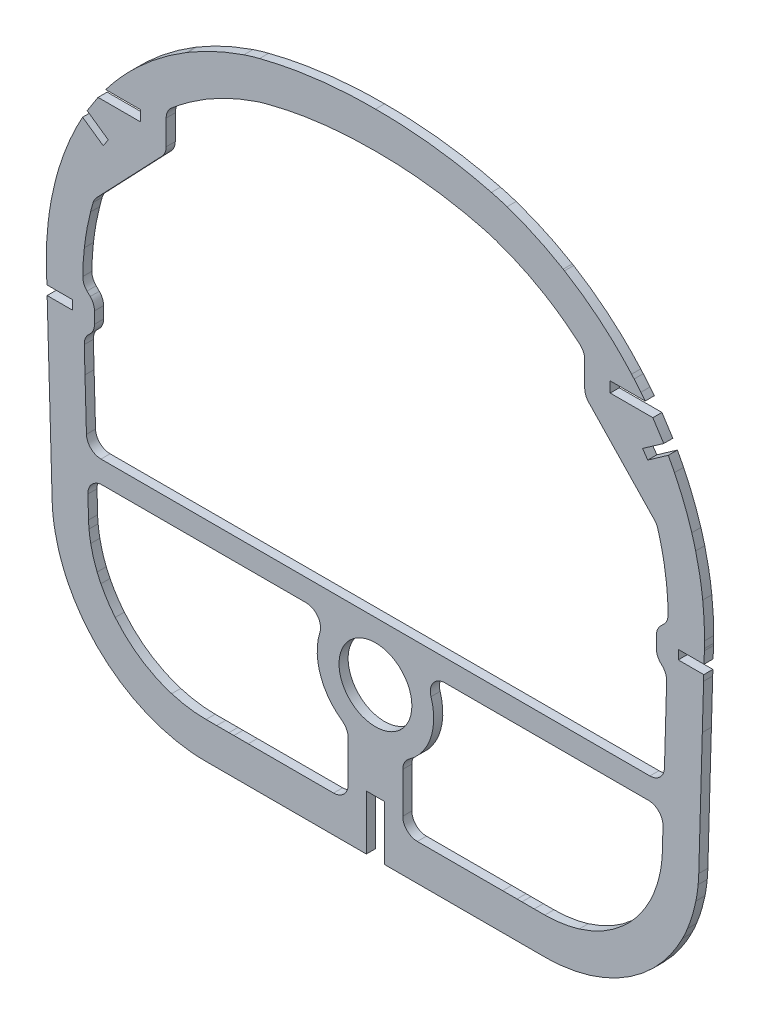
from build123d import *

# Parameters (mm, degrees)
SKETCH1_R           = 12.700000000000001
BOSS_EXTRUDE1_DEPTH = 1.5875
SKETCH2_R           = 20.320000000000004
CUT_EXTRUDE1_DEPTH  = 169.34386796933504
BOSS_EXTRUDE2_START = -3.175
BOSS_EXTRUDE2_DEPTH = 3.175
CUT_EXTRUDE3_DEPTH  = 169.34386796933504
FILLET1_R           = 5.08


with BuildPart() as part:
    # Sketch1 → Boss-Extrude1 (new, symmetric)
    with BuildSketch(Plane.XY):
        with BuildLine():
            Line((-114.7452197006329, 17.502683519570404), (-114.72594109896555, 16.83199064857102))
            add(Edge.make_bspline(
                [(-114.72594109896555, 16.83199064857102), (-114.63641058990241, 13.717126836218588), (-114.54692036583873, 10.602259401409691), (-114.45747777614487, 7.487385264694304)],
                knots=[0, 0, 0, 0, 1, 1, 1, 1], degree=3, weights=[1, 1, 1, 1]))
            add(Edge.make_bspline(
                [(-114.45747777614487, 7.487385264694304), (-114.30718797143473, 2.253479661651684), (-114.15700866213814, -2.980453956785725), (-114.00699685839271, -8.214429233663035)],
                knots=[0, 0, 0, 0, 1, 1, 1, 1], degree=3, weights=[1, 1, 1, 1]))
            add(Edge.make_bspline(
                [(-114.00699685839271, -8.214429233663035), (-113.594092007642, -22.620853681126103), (-113.18138690950695, -37.02768380672695), (-112.76874515326054, -51.434848977248656)],
                knots=[0, 0, 0, 0, 1, 1, 1, 1], degree=3, weights=[1, 1, 1, 1]))
            ThreePointArc((-112.76874515326054, -51.434848977248656), (-112.68804333866615, -53.1759331373922), (-112.55087678962421, -54.91348088447918))
            ThreePointArc((-112.55087678962421, -54.91348088447918), (-112.22797864595222, -57.58878393541259), (-111.77128477130692, -60.244521183405745))
            add(Edge.make_bspline(
                [(-111.77128477130692, -60.244521183405745), (-111.1073733148537, -63.598835081976574), (-110.12206449281399, -66.88944897002129), (-108.83322390889208, -70.0566544796016)],
                knots=[0, 0, 0, 0, 1, 1, 1, 1], degree=3, weights=[1, 1, 1, 1]))
            ThreePointArc((-108.83322390889208, -70.0566544796016), (-108.01356493798, -71.96435471079279), (-107.12076116778223, -73.83893797877646))
            add(Edge.make_bspline(
                [(-107.12076116778223, -73.83893797877646), (-105.32883254477298, -77.42121554975256), (-103.13441882445123, -80.80203517755982), (-100.59192102351365, -83.8972820272281)],
                knots=[0, 0, 0, 0, 1, 1, 1, 1], degree=3, weights=[1, 1, 1, 1]))
            add(Edge.make_bspline(
                [(-100.59192102351365, -83.8972820272281), (-95.59242527238186, -89.98368785895089), (-89.40102010512265, -95.0940325478926), (-82.31665423774274, -98.86998494857941), (-74.78459324955335, -101.17197690928097)],
                knots=[0, 0, 0, 0, 0, 1, 1, 1, 1, 1], degree=4, weights=[1, 1, 1, 1, 1]))
            add(Edge.make_bspline(
                [(-74.78459324955335, -101.17197690928097), (-69.70375314313806, -102.72481259724978), (-64.39158382619704, -103.51812327161942), (-59.07890091428872, -103.51750007032157)],
                knots=[0, 0, 0, 0, 1, 1, 1, 1], degree=3, weights=[1, 1, 1, 1]))
            add(Edge.make_bspline(
                [(-59.07890091428872, -103.51750007032157), (-57.846433259477166, -103.51735549787801), (-56.61397530630568, -103.51723826558838), (-55.38152448537701, -103.517145846477)],
                knots=[0, 0, 0, 0, 1, 1, 1, 1], degree=3, weights=[1, 1, 1, 1]))
            add(Edge.make_bspline(
                [(-55.38152448537701, -103.517145846477), (-53.95716671470069, -103.51703903855777), (-52.53281923226491, -103.51696799755912), (-51.10847777162478, -103.5169356729528)],
                knots=[0, 0, 0, 0, 1, 1, 1, 1], degree=3, weights=[1, 1, 1, 1]))
            Line((-51.10847777162478, -103.5169356729528), (-49.37860046686426, -103.51691546671823))
            add(Edge.make_bspline(
                [(-49.37860046686426, -103.51691546671823), (-47.71016069532774, -103.5169146296126), (-46.04172764724473, -103.51696183124892), (-44.37329370146884, -103.51707762925778)],
                knots=[0, 0, 0, 0, 1, 1, 1, 1], degree=3, weights=[1, 1, 1, 1]))
            add(Edge.make_bspline(
                [(-44.37329370146884, -103.51707762925778), (-29.582422277033825, -103.51810415951752), (-14.791380965373275, -103.51962644471186), (-1.5811525e-09, -103.52167238588633)],
                knots=[0, 0, 0, 0, 1, 1, 1, 1], degree=3, weights=[1, 1, 1, 1]))
            add(Edge.make_bspline(
                [(44.37329370146884, -103.51707762925778), (29.582422277033825, -103.51810415951752), (14.791380965373275, -103.51962644471186), (-1.5811525e-09, -103.52167238588633)],
                knots=[0, 0, 0, 0, 1, 1, 1, 1], degree=3, weights=[1, 1, 1, 1]))
            add(Edge.make_bspline(
                [(49.37860046686426, -103.51691546671823), (47.71016069532774, -103.5169146296126), (46.04172764724473, -103.51696183124892), (44.37329370146884, -103.51707762925778)],
                knots=[0, 0, 0, 0, 1, 1, 1, 1], degree=3, weights=[1, 1, 1, 1]))
            Line((49.37860046686426, -103.51691546671823), (51.10847777162478, -103.5169356729528))
            add(Edge.make_bspline(
                [(55.38152448537701, -103.517145846477), (53.95716671470069, -103.51703903855777), (52.53281923226491, -103.51696799755912), (51.10847777162478, -103.5169356729528)],
                knots=[0, 0, 0, 0, 1, 1, 1, 1], degree=3, weights=[1, 1, 1, 1]))
            add(Edge.make_bspline(
                [(59.07890091428872, -103.51750007032157), (57.846433259477166, -103.51735549787801), (56.61397530630568, -103.51723826558838), (55.38152448537701, -103.517145846477)],
                knots=[0, 0, 0, 0, 1, 1, 1, 1], degree=3, weights=[1, 1, 1, 1]))
            add(Edge.make_bspline(
                [(74.78459324955335, -101.17197690928097), (69.70375314313806, -102.72481259724978), (64.39158382619704, -103.51812327161942), (59.07890091428872, -103.51750007032157)],
                knots=[0, 0, 0, 0, 1, 1, 1, 1], degree=3, weights=[1, 1, 1, 1]))
            add(Edge.make_bspline(
                [(100.59192102351365, -83.8972820272281), (95.59242527238186, -89.98368785895089), (89.40102010512265, -95.0940325478926), (82.31665423774274, -98.86998494857941), (74.78459324955335, -101.17197690928097)],
                knots=[0, 0, 0, 0, 0, 1, 1, 1, 1, 1], degree=4, weights=[1, 1, 1, 1, 1]))
            add(Edge.make_bspline(
                [(107.12076116778223, -73.83893797877646), (105.32883254477298, -77.42121554975256), (103.13441882445123, -80.80203517755982), (100.59192102351365, -83.8972820272281)],
                knots=[0, 0, 0, 0, 1, 1, 1, 1], degree=3, weights=[1, 1, 1, 1]))
            ThreePointArc((107.12076116778223, -73.83893797877646), (108.01356493798, -71.9643547107928), (108.83322390889208, -70.0566544796016))
            add(Edge.make_bspline(
                [(111.77128477130692, -60.244521183405745), (111.1073733148537, -63.598835081976574), (110.12206449281399, -66.88944897002129), (108.83322390889208, -70.0566544796016)],
                knots=[0, 0, 0, 0, 1, 1, 1, 1], degree=3, weights=[1, 1, 1, 1]))
            ThreePointArc((111.77128477130692, -60.244521183405745), (112.22797864595222, -57.58878393541259), (112.55087678962421, -54.91348088447918))
            ThreePointArc((112.55087678962421, -54.91348088447918), (112.68804333866615, -53.17593313739219), (112.76874515326054, -51.434848977248656))
            add(Edge.make_bspline(
                [(114.00699685839271, -8.214429233663035), (113.594092007642, -22.620853681126103), (113.18138690950695, -37.02768380672695), (112.76874515326054, -51.434848977248656)],
                knots=[0, 0, 0, 0, 1, 1, 1, 1], degree=3, weights=[1, 1, 1, 1]))
            add(Edge.make_bspline(
                [(114.45747777614487, 7.487385264694304), (114.30718797143473, 2.253479661651684), (114.15700866213814, -2.980453956785725), (114.00699685839271, -8.214429233663035)],
                knots=[0, 0, 0, 0, 1, 1, 1, 1], degree=3, weights=[1, 1, 1, 1]))
            add(Edge.make_bspline(
                [(114.72594109896555, 16.83199064857102), (114.63641058990241, 13.717126836218588), (114.54692036583873, 10.602259401409691), (114.45747777614487, 7.487385264694304)],
                knots=[0, 0, 0, 0, 1, 1, 1, 1], degree=3, weights=[1, 1, 1, 1]))
            Line((114.72594109896555, 16.83199064857102), (114.7452197006329, 17.502683519570404))
            add(Edge.make_bspline(
                [(114.7890059115134, 19.863219176694063), (114.7835780692486, 19.076239431927775), (114.76783208153577, 18.289356898186814), (114.7452197006329, 17.502683519570404)],
                knots=[0, 0, 0, 0, 0.9999498505076996, 0.9999498505076996, 0.9999498505076996, 0.9999498505076996], degree=3, weights=[1, 1, 1, 1]))
            add(Edge.make_bspline(
                [(114.15894327556961, 31.865695052286362), (114.60613845908075, 27.882027971749473), (114.81665344143374, 23.871808144028062), (114.7890059115134, 19.863219176694063)],
                knots=[0, 0, 0, 0, 1, 1, 1, 1], degree=3, weights=[1, 1, 1, 1]))
            add(Edge.make_bspline(
                [(111.684573502519, 45.4610336377593), (112.81734049393746, 40.992572366905875), (113.64469045396903, 36.44671950470451), (114.15894327556961, 31.865695052286362)],
                knots=[0, 0, 0, 0, 1, 1, 1, 1], degree=3, weights=[1, 1, 1, 1]))
            ThreePointArc((111.684573502519, 45.4610336377593), (111.03906135213371, 47.88139437458557), (110.3339195986165, 50.28505972985278))
            add(Edge.make_bspline(
                [(104.30641025218718, 65.4477511057322), (106.71886285229947, 60.56649996133052), (108.73674389160301, 55.49036874894405), (110.3339195986165, 50.28505972985278)],
                knots=[0, 0, 0, 0, 1, 1, 1, 1], degree=3, weights=[1, 1, 1, 1]))
            add(Edge.make_bspline(
                [(92.59150342724206, 83.84885261225975), (97.14327095044497, 78.16017149746612), (101.07854504066823, 71.97887259239612), (104.30641025218718, 65.4477511057322)],
                knots=[0.00015516687657362, 0.00015516687657362, 0.00015516687657362, 0.00015516687657362, 1, 1, 1, 1], degree=3, weights=[1, 1, 1, 1]))
            ThreePointArc((92.59150342724206, 83.84885261225975), (91.42507816905498, 85.2796957156788), (90.23277102888983, 86.6890443428995))
            ThreePointArc((90.23277102888983, 86.6890443428995), (89.79223213194632, 87.19683786942522), (89.34833219659208, 87.70169590196916))
            add(Edge.make_bspline(
                [(65.94432999771517, 107.22681485913718), (74.66889148105416, 101.94541730184362), (82.58894175346335, 95.33803001789981), (89.34833219659208, 87.70169590196916)],
                knots=[0, 0, 0, 0, 1, 1, 1, 1], degree=3, weights=[1, 1, 1, 1]))
            Line((65.94432999771517, 107.22681485913718), (65.49624085564622, 107.49648616368657))
            add(Edge.make_bspline(
                [(45.895792552675076, 116.5445185858013), (52.726322535675486, 114.23712446443145), (59.3094251803046, 111.19813338148634), (65.49624085564622, 107.49648616368657)],
                knots=[0, 0, 0, 0, 1, 1, 1, 1], degree=3, weights=[1, 1, 1, 1]))
            ThreePointArc((45.895792552675076, 116.5445185858013), (43.17799654744927, 117.40316616219629), (40.42839902855836, 118.1537687671607))
            add(Edge.make_bspline(
                [(40.42839902855836, 118.1537687671607), (39.33806183749876, 118.42838758689368), (37.1574632082568, 118.97760614678802), (33.85630153491988, 119.7094898902904), (30.535885824062376, 120.37426223953587), (27.19582924530948, 120.96549094489052), (23.838631119796016, 121.48509536527982), (20.465916690485443, 121.93269365848225), (17.079460248796543, 122.30850094608213), (13.680927413418125, 122.6123574228248), (10.271955070812115, 122.84468791805438), (6.8541610765224625, 123.00360566536389), (3.429096591574733, 123.09552645722273), (1.143477199439534, 123.09552645720133), (-1.58115076e-09, 123.09552645719057)],
                knots=[0, 0, 0, 0, 0.08319982321872643, 0.16639386599995798, 0.24958922098778757, 0.3327940500648784, 0.41601744163079, 0.49926927384300424, 0.5825600915037497, 0.6659009868953494, 0.7493034844056105, 0.8327794289788419, 0.9163408784672036, 1, 1, 1, 1], degree=3))
            add(Edge.make_bspline(
                [(-40.42839902855836, 118.1537687671607), (-39.33806183758537, 118.42838758688279), (-37.157463208516646, 118.97760614675535), (-33.85630153544102, 119.7094898902324), (-30.535885824845685, 120.37426223945792), (-27.19582924635577, 120.96549094479849), (-23.838631121105937, 121.48509536517938), (-20.465916692059512, 121.93269365837907), (-17.079460250635144, 122.30850094598189), (-13.680927415521507, 122.61235742273314), (-10.27195507318041, 122.84468791797694), (-6.854161079155658, 123.00360566530641), (-3.4290965944727594, 123.09552645719042), (-1.1434772025137092, 123.09552645719056), (-1.58115076e-09, 123.09552645719057)],
                knots=[0, 0, 0, 0, 0.08319982321872643, 0.16639386599995798, 0.24958922098778757, 0.3327940500648784, 0.41601744163079, 0.49926927384300424, 0.5825600915037497, 0.6659009868953494, 0.7493034844056105, 0.8327794289788419, 0.9163408784672036, 1, 1, 1, 1], degree=3))
            ThreePointArc((-40.42839902855836, 118.1537687671607), (-43.17799654744926, 117.4031661621963), (-45.895792552675076, 116.5445185858013))
            add(Edge.make_bspline(
                [(-45.895792552675076, 116.5445185858013), (-52.726322535675486, 114.23712446443145), (-59.3094251803046, 111.19813338148634), (-65.49624085564622, 107.49648616368657)],
                knots=[0, 0, 0, 0, 1, 1, 1, 1], degree=3, weights=[1, 1, 1, 1]))
            Line((-65.49624085564622, 107.49648616368657), (-65.94432999771517, 107.22681485913718))
            add(Edge.make_bspline(
                [(-65.94432999771517, 107.22681485913718), (-74.66889148105416, 101.94541730184362), (-82.58894175346335, 95.33803001789981), (-89.34833219659208, 87.70169590196916)],
                knots=[0, 0, 0, 0, 1, 1, 1, 1], degree=3, weights=[1, 1, 1, 1]))
            ThreePointArc((-89.34833219659208, 87.70169590196916), (-89.79223213194632, 87.19683786942522), (-90.23277102888983, 86.6890443428995))
            ThreePointArc((-90.23277102888983, 86.6890443428995), (-91.42507816905497, 85.27969571567883), (-92.59150342724206, 83.84885261225975))
            add(Edge.make_bspline(
                [(-92.59150342724206, 83.84885261225975), (-97.14327095044497, 78.16017149746612), (-101.07854504066823, 71.97887259239612), (-104.30641025218718, 65.4477511057322)],
                knots=[0.00015516687657362, 0.00015516687657362, 0.00015516687657362, 0.00015516687657362, 1, 1, 1, 1], degree=3, weights=[1, 1, 1, 1]))
            add(Edge.make_bspline(
                [(-104.30641025218718, 65.4477511057322), (-106.71886285229947, 60.56649996133052), (-108.73674389160301, 55.49036874894405), (-110.3339195986165, 50.28505972985278)],
                knots=[0, 0, 0, 0, 1, 1, 1, 1], degree=3, weights=[1, 1, 1, 1]))
            ThreePointArc((-110.3339195986165, 50.28505972985278), (-111.03906135213371, 47.881394374585554), (-111.684573502519, 45.4610336377593))
            add(Edge.make_bspline(
                [(-111.684573502519, 45.4610336377593), (-112.81734049393746, 40.992572366905875), (-113.64469045396903, 36.44671950470451), (-114.15894327556961, 31.865695052286362)],
                knots=[0, 0, 0, 0, 1, 1, 1, 1], degree=3, weights=[1, 1, 1, 1]))
            add(Edge.make_bspline(
                [(-114.15894327556961, 31.865695052286362), (-114.60613845908075, 27.882027971749473), (-114.81665344143374, 23.871808144028062), (-114.7890059115134, 19.863219176694063)],
                knots=[0, 0, 0, 0, 1, 1, 1, 1], degree=3, weights=[1, 1, 1, 1]))
            add(Edge.make_bspline(
                [(-114.7890059115134, 19.863219176694063), (-114.7835780692486, 19.076239431927775), (-114.76783208153577, 18.289356898186814), (-114.7452197006329, 17.502683519570404)],
                knots=[0, 0, 0, 0, 0.9999498505076996, 0.9999498505076996, 0.9999498505076996, 0.9999498505076996], degree=3, weights=[1, 1, 1, 1]))
        make_face()
        with Locations((0, -50.8)):
            Circle(SKETCH1_R, mode=Mode.SUBTRACT)
    extrude(amount=BOSS_EXTRUDE1_DEPTH, both=True)

    # Sketch2 → Cut-Extrude1 (cut, through all)
    with BuildSketch(Plane.XY.offset(1.5875)):
        with BuildLine():
            Line((-102.05046304501089, 17.867585498929238), (-102.03118420379151, 17.19688429403577))
            add(Edge.make_bspline(
                [(-102.03118420379151, 17.19688429403577), (-102.00880074568765, 16.41813943518699), (-101.96403890957323, 14.860650807524046), (-101.89691177324582, 12.524410000891692), (-101.82980105137004, 10.18816478438498), (-101.78507189346547, 8.630662089436115), (-101.76271032129195, 7.851911350464416)],
                knots=[-8.9129106647e-07, -8.9129106647e-07, -8.9129106647e-07, -8.9129106647e-07, 0.24999933153170015, 0.49999955435446675, 0.7499997771772333, 1, 1, 1, 1], degree=3))
            add(Edge.make_bspline(
                [(-101.76271032129195, 7.851911350464416), (-101.72513644418133, 6.543385290985036), (-101.65000280099126, 3.926340070305929), (-101.53734822694257, 0.00072939642337794), (-101.42474548905955, -3.9249044925446195), (-101.34971468786911, -6.542025090419771), (-101.31220993120635, -7.850581912197028)],
                knots=[0, 0, 0, 0, 0.25, 0.5, 0.75, 1, 1, 1, 1], degree=3))
            add(Edge.make_bspline(
                [(-101.31220993120635, -7.850581912197028), (-101.20900572823022, -11.451420095940556), (-101.00262463643593, -18.6530649395015), (-100.69311365187139, -29.45572791211675), (-100.38365329188234, -40.25848396259931), (-100.17736995172882, -47.4604370312094), (-100.07423324793606, -51.0613993294313)],
                knots=[0, 0, 0, 0, 0.2499430109272707, 0.4998860218545414, 0.7498290327818121, 0.9997720437090828, 0.9997720437090828, 0.9997720437090828, 0.9997720437090828], degree=3))
            ThreePointArc((-100.07423324793606, -51.0613993294313), (-100.01261182717461, -52.38633841552202), (-99.90816190893503, -53.70859065920598))
            ThreePointArc((-99.90816190893503, -53.70859065920598), (-99.66163291628735, -55.75113462094698), (-99.31295711405238, -57.77874098432134))
            add(Edge.make_bspline(
                [(-99.31295711405238, -57.77874098432134), (-99.18629820756037, -58.41866084206956), (-98.90236460900753, -59.692255532014435), (-98.38522585746843, -61.58227401578457), (-97.77853202516384, -63.4454753308098), (-97.31578928202734, -64.66552433544275), (-97.0699125288233, -65.26974468553459)],
                knots=[8.43480030505e-06, 8.43480030505e-06, 8.43480030505e-06, 8.43480030505e-06, 0.2500054480585301, 0.5000024613167552, 0.7499994745749803, 0.9999964878332054, 0.9999964878332054, 0.9999964878332054, 0.9999964878332054], degree=3))
            ThreePointArc((-97.0699125288233, -65.26974468553459), (-96.44413848330768, -66.72618981171381), (-95.76252267250297, -68.15735208346123))
            add(Edge.make_bspline(
                [(-95.76252267250297, -68.15735208346123), (-95.42072188376622, -68.84065093508114), (-94.69887081665928, -70.1877942842476), (-93.50307408806886, -72.14785264783423), (-92.19969597359791, -74.0380529132366), (-91.26318901742911, -75.24578261555591), (-90.77825654130869, -75.83614132440513)],
                knots=[3.67711913523e-06, 3.67711913523e-06, 3.67711913523e-06, 3.67711913523e-06, 0.2500027578393514, 0.5000018385595676, 0.7500009192797839, 1, 1, 1, 1], degree=3))
            add(Edge.make_bspline(
                [(-90.77825654130869, -75.83614132440513), (-89.5068666996648, -77.38393632849585), (-86.73246204698775, -80.2974199077113), (-81.9810924504027, -84.00890073067299), (-76.73882276751849, -86.98682408691383), (-72.98807379122894, -88.44114372697547), (-71.0726378596952, -89.02655031390347)],
                knots=[0, 0, 0, 0, 0.25, 0.5, 0.75, 1, 1, 1, 1], degree=3))
            add(Edge.make_bspline(
                [(-71.0726378596952, -89.02655031390347), (-70.10382176731555, -89.32264548159553), (-68.14473406941967, -89.84228531511037), (-65.14840486386493, -90.40375090675532), (-62.11878846703002, -90.74220704745068), (-60.09341988424078, -90.81761899052385), (-59.080390680675904, -90.81750015769968)],
                knots=[0, 0, 0, 0, 0.25, 0.5, 0.75, 1, 1, 1, 1], degree=3))
            add(Edge.make_bspline(
                [(-59.080390680675904, -90.81750015769968), (-58.77222793445742, -90.81746400921249), (-58.155900800659786, -90.81739512994476), (-57.23142012830801, -90.81730182892072), (-56.30694426326282, -90.81721830822251), (-55.690633155068674, -90.81716899023291), (-55.38247683389354, -90.81714588218439)],
                knots=[0, 0, 0, 0, 0.25, 0.5, 0.75, 1, 1, 1, 1], degree=3))
            add(Edge.make_bspline(
                [(-55.38247683389354, -90.81714588218439), (-55.026328467618264, -90.81711917578609), (-54.31403171190898, -90.81707023455843), (-53.24558692028407, -90.81701051424052), (-52.17714195004347, -90.81696476177872), (-51.46484462999912, -90.81694375722223), (-51.10869605403507, -90.81693567463611)],
                knots=[0, 0, 0, 0, 0.2500040917593769, 0.5000081835187538, 0.7500122752781306, 1.0000163670375075, 1.0000163670375075, 1.0000163670375075, 1.0000163670375075], degree=3))
            Line((-51.10869605403507, -90.81693567463611), (-49.37867782580123, -90.81691546675545))
            add(Edge.make_bspline(
                [(-49.37867782580123, -90.81691546675545), (-48.96149814615948, -90.81691525744405), (-48.127143203246426, -90.81692084348609), (-46.87558429083459, -90.81694916933752), (-45.62401153224609, -90.81699936889878), (-44.7896104068153, -90.81704870412081), (-44.37241225530023, -90.81707765984626)],
                knots=[-1.418230617083e-05, -1.418230617083e-05, -1.418230617083e-05, -1.418230617083e-05, 0.24998936327037188, 0.4999929088469146, 0.7499964544234573, 1, 1, 1, 1], degree=3))
            add(Edge.make_bspline(
                [(-44.37241225530023, -90.81707765984626), (-40.67475786507488, -90.81733428800648), (-33.5817552245195, -90.8178859946959), (-24.63983871217231, -90.81872725376154), (-17.244432865936744, -90.81951326702921), (-9.546700393673413, -90.82040355381663), (-3.697752930631585, -90.82116080223688), (-1.060272e-11, -90.82167226439844)],
                knots=[0, 0, 0, 0, 0.2499901033324907, 0.4795432670368797, 0.604538318703125, 0.749970309997472, 0.9999604133299628, 0.9999604133299628, 0.9999604133299628, 0.9999604133299628], degree=3))
            add(Edge.make_bspline(
                [(-1.060272e-11, -90.82167226439844), (3.697752930609162, -90.82116080223688), (9.54670039365822, -90.8204035538166), (17.244432865929777, -90.8195132670292), (24.63983871216943, -90.81872725376152), (33.58175522451756, -90.81788599469587), (40.67475786507284, -90.81733428800648), (44.372412283877324, -90.81707765984429)],
                knots=[3.958666948614e-05, 3.958666948614e-05, 3.958666948614e-05, 3.958666948614e-05, 0.2500296900021146, 0.3954616812968122, 0.5204567329631264, 0.7500098966673716, 1, 1, 1, 1], degree=3))
            add(Edge.make_bspline(
                [(44.372412283877324, -90.81707765984429), (44.78961040671183, -90.81704870412082), (45.624011531935736, -90.8169993688988), (46.87558429021371, -90.81694916933753), (48.127143202315146, -90.81692084348612), (48.96149814502146, -90.81691525744405), (49.378677824559816, -90.81691546675545)],
                knots=[0, 0, 0, 0, 0.2500035455145379, 0.5000070910290758, 0.7500106365436137, 1.0000141820581516, 1.0000141820581516, 1.0000141820581516, 1.0000141820581516], degree=3))
            Line((49.378677824559816, -90.81691546675545), (51.108696054035065, -90.81693567463611))
            add(Edge.make_bspline(
                [(51.108696054035065, -90.81693567463611), (51.46484462999911, -90.81694375722223), (52.177141950043456, -90.81696476177869), (53.245586920284026, -90.81701051424054), (54.3140317119089, -90.81707023455843), (55.02632846761824, -90.81711917578609), (55.38247681673545, -90.81714588218311)],
                knots=[-1.636703750918e-05, -1.636703750918e-05, -1.636703750918e-05, -1.636703750918e-05, 0.24998772472186812, 0.4999918164812454, 0.7499959082406227, 1, 1, 1, 1], degree=3))
            add(Edge.make_bspline(
                [(55.38247681673545, -90.81714588218311), (55.69063315506869, -90.81716899023291), (56.30694426326287, -90.8172183082225), (57.23142012830801, -90.81730182892075), (58.155900800659744, -90.8173951299447), (58.772227934457405, -90.81746400921249), (59.08039066536946, -90.81750015769789)],
                knots=[0, 0, 0, 0, 0.25, 0.5, 0.75, 1, 1, 1, 1], degree=3))
            add(Edge.make_bspline(
                [(59.08039066536946, -90.81750015769789), (60.09341988424078, -90.81761899052385), (62.11878846703002, -90.7422070474507), (65.14840486386494, -90.4037509067553), (68.14473406941966, -89.84228531511037), (70.10382176731555, -89.32264548159553), (71.07263785161442, -89.02655031637316)],
                knots=[0, 0, 0, 0, 0.25, 0.5, 0.75, 1, 1, 1, 1], degree=3))
            add(Edge.make_bspline(
                [(71.07263785161442, -89.02655031637316), (72.98807379122894, -88.44114372697547), (76.73882276751851, -86.98682408691383), (81.98109245040266, -84.00890073067303), (86.73246204698773, -80.29741990771124), (89.5068666996648, -77.38393632849585), (90.77825654919137, -75.83614131480874)],
                knots=[0, 0, 0, 0, 0.25, 0.5, 0.75, 1, 1, 1, 1], degree=3))
            add(Edge.make_bspline(
                [(90.77825654919137, -75.83614131480874), (91.2631890173243, -75.24578261568351), (92.19969597329778, -74.03805291363123), (93.50307408752082, -72.14785264866154), (94.69887081591197, -70.1877942855346), (95.42072188292087, -68.84065093668812), (95.76252267161738, -68.15735208523164)],
                knots=[0, 0, 0, 0, 0.24999908066620047, 0.49999816133240094, 0.7499972419986014, 0.9999963226648019, 0.9999963226648019, 0.9999963226648019, 0.9999963226648019], degree=3))
            ThreePointArc((95.76252267161738, -68.15735208523164), (96.44413848264907, -66.72618981316852), (97.06991252836568, -65.26974468665921))
            add(Edge.make_bspline(
                [(97.06991252836568, -65.26974468665921), (97.31578926594958, -64.66552437500391), (97.77853198152432, -63.44547544874921), (98.38522578373491, -61.582274255118016), (98.90236451677828, -59.69225589547733), (99.1862981109365, -58.41866128920468), (99.31295701722328, -57.7787414735317)],
                knots=[3.51201162711e-06, 3.51201162711e-06, 3.51201162711e-06, 3.51201162711e-06, 0.2500005093742845, 0.4999975067369418, 0.7499945040995992, 0.9999915014622566, 0.9999915014622566, 0.9999915014622566, 0.9999915014622566], degree=3))
            ThreePointArc((99.31295701722328, -57.7787414735317), (99.66163293864912, -55.75113446798273), (99.90816198558139, -53.70858985496883))
            ThreePointArc((99.90816198558139, -53.70858985496883), (100.0126118523438, -52.38633801443182), (100.07423324781801, -51.061399333552586))
            add(Edge.make_bspline(
                [(100.07423324781801, -51.061399333552586), (100.1773699516206, -47.46043703498724), (100.3836532917938, -40.2584839656902), (100.69311365181237, -29.45572791417735), (101.0026246364064, -18.653064940531777), (101.20900572822039, -11.451420096283982), (101.31220993151321, -7.850581901490445)],
                knots=[0.00022795619556494, 0.00022795619556494, 0.00022795619556494, 0.00022795619556494, 0.2501709671466737, 0.5001139780977825, 0.7500569890488913, 1, 1, 1, 1], degree=3))
            add(Edge.make_bspline(
                [(101.31220993151321, -7.850581901490445), (101.34971468786911, -6.542025090419769), (101.42474548905955, -3.9249044925446057), (101.53734822694258, 0.00072939642335994), (101.65000280099126, 3.9263400703059212), (101.72513644418133, 6.543385290985033), (101.76271031580394, 7.851911159342872)],
                knots=[0, 0, 0, 0, 0.25, 0.5, 0.75, 1, 1, 1, 1], degree=3))
            add(Edge.make_bspline(
                [(101.76271031580394, 7.851911159342872), (101.78507189346567, 8.63066208944247), (101.82980105137051, 10.188164784404048), (101.89691177324696, 12.524410000929816), (101.96403890957487, 14.86065080758139), (102.00880074568964, 16.418139435256986), (102.0311842037937, 17.19688429411211)],
                knots=[0, 0, 0, 0, 0.2500002228248089, 0.5000004456496178, 0.7500006684744267, 1.0000008912992355, 1.0000008912992355, 1.0000008912992355, 1.0000008912992355], degree=3))
            Line((102.0311842037937, 17.19688429411211), (102.05046304501089, 17.867585498929238))
            add(Edge.make_bspline(
                [(102.05046304501089, 17.867585498929238), (102.05555198514352, 18.044627171140018), (102.0650008891123, 18.40047180154699), (102.07631905368208, 18.92387061955839), (102.08469204339556, 19.442100282331676), (102.0881344197804, 19.78065786474588), (102.08930796618628, 19.95080968676288)],
                knots=[0, 0, 0, 0, 0.2499874626269249, 0.4999749252538498, 0.7499623878807746, 0.9999498505076996, 0.9999498505076996, 0.9999498505076996, 0.9999498505076996], degree=3))
            add(Edge.make_bspline(
                [(102.08930796618628, 19.95080968676288), (102.09535292384417, 20.827262326300833), (102.08140729892692, 22.580361418828584), (101.98248437874895, 25.20872118348459), (101.80567327412868, 27.832993934594363), (101.63599195959017, 29.577923302578082), (101.53821545127961, 30.448927892449515)],
                knots=[0, 0, 0, 0, 0.25, 0.5, 0.75, 1, 1, 1, 1], degree=3))
            add(Edge.make_bspline(
                [(101.53821545127961, 30.448927892449515), (101.42578092909513, 31.45050780370795), (101.16668301096348, 33.449848275612155), (100.67586695416037, 36.43458947012108), (100.08359076333828, 39.40086501355609), (99.62164268863994, 41.36328732806594), (99.37397869964666, 42.340255593812515)],
                knots=[0, 0, 0, 0, 0.2499998188868767, 0.4999996377737534, 0.7499994566606301, 0.9999992755475068, 0.9999992755475068, 0.9999992755475068, 0.9999992755475068], degree=3))
            ThreePointArc((99.37397869964666, 42.340255593812515), (98.80937085295291, 44.45726378503892), (98.19260726681969, 46.55966916485713))
            add(Edge.make_bspline(
                [(98.19260726681969, 46.55966916485713), (97.84345566195333, 47.697579032794856), (97.09915665992513, 49.95932486106072), (95.84647491920826, 53.30533976886939), (94.46005372829133, 56.59819957707514), (93.44839933390465, 58.75369615598407), (92.92102148983902, 59.820769434338864)],
                knots=[0, 0, 0, 0, 0.25, 0.5, 0.75, 1, 1, 1, 1], degree=3))
            add(Edge.make_bspline(
                [(92.92102148983902, 59.820769434338864), (92.21548803284107, 61.2483150158941), (90.72707584657853, 64.06526178809665), (88.26847470328808, 68.16681609260584), (85.59263785173759, 72.13014281908018), (83.67007988477111, 74.6709374256886), (82.67516909110866, 75.91435115759849)],
                knots=[0.00015516687657362, 0.00015516687657362, 0.00015516687657362, 0.00015516687657362, 0.2501163751574302, 0.5000775834382868, 0.7500387917191433, 1, 1, 1, 1], degree=3))
            ThreePointArc((82.67516909110866, 75.91435115759849), (81.65498846378713, 77.16579732154631), (80.61217098558929, 78.39844395411646))
            ThreePointArc((80.61217098558929, 78.39844395411646), (80.22687625477269, 78.84255939544417), (79.83864206896111, 79.2841075491901))
            add(Edge.make_bspline(
                [(79.83864206896111, 79.2841075491901), (78.362419755589, 80.95184993761991), (75.28311452737069, 84.17530614283795), (70.30738583476118, 88.65469182548489), (65.00932069546128, 92.74790914252326), (61.2863322048114, 95.20037670594242), (59.38111355926563, 96.3541667315568)],
                knots=[7.0229520058e-07, 7.0229520058e-07, 7.0229520058e-07, 7.0229520058e-07, 0.24985235307812562, 0.4997040038610506, 0.7495556546439757, 0.9994073054269007, 0.9994073054269007, 0.9994073054269007, 0.9994073054269007], degree=3))
            Line((59.38111355926563, 96.3541667315568), (58.962072488487195, 96.60635617693106))
            add(Edge.make_bspline(
                [(58.962072488487195, 96.60635617693106), (57.6105887967087, 97.41463586120183), (54.86430448145778, 98.95894080249835), (50.62489881658705, 101.0540472759125), (46.280089057031745, 102.92071293409039), (43.32319375186885, 104.00851148615602), (41.8312984434788, 104.51248269671301)],
                knots=[0.0008382597391761, 0.0008382597391761, 0.0008382597391761, 0.0008382597391761, 0.25062869480438205, 0.500419129869588, 0.750209564934794, 1, 1, 1, 1], degree=3))
            ThreePointArc((41.8312984434788, 104.51248269671301), (39.5920368262576, 105.21994438476844), (37.32657312697299, 105.8383850510009))
            add(Edge.make_bspline(
                [(37.32657312697299, 105.8383850510009), (36.92530856620725, 105.93944993348103), (36.11119988877999, 106.14447337351622), (34.958304093100374, 106.42983511908851), (33.856064431472966, 106.69300557999736), (32.369380378047225, 107.0311468077866), (30.45622831449002, 107.43939678098556), (27.402681228722333, 108.04166849664509), (23.559199224428657, 108.69958884332928), (18.90630305620638, 109.34205694603185), (14.223403122214032, 109.83515056468693), (10.305878354632908, 110.12247644489572), (7.161744759279607, 110.2765503137651), (5.181542217891477, 110.34430997249517), (3.631808636081472, 110.37767877013877), (2.476199978342701, 110.39092951997526), (1.2687523576716555, 110.3955068589017), (0.41920210030430516, 110.39552645719452), (-1.46176332e-09, 110.39552645719058)],
                knots=[0, 0, 0, 0, 0.03125, 0.0625, 0.09375, 0.125, 0.1875, 0.25, 0.375, 0.5, 0.625, 0.75, 0.8125, 0.875, 0.90625, 0.9375, 0.96875, 1, 1, 1, 1], degree=3))
            add(Edge.make_bspline(
                [(-1.46176332e-09, 110.39552645719058), (-0.4192021033141629, 110.39552645719057), (-1.2687523606152538, 110.39550685888972), (-2.476199981187748, 110.39092951995234), (-3.631808638827716, 110.37767877010603), (-5.181542220505861, 110.34430997245072), (-7.161744761728865, 110.27655031370762), (-10.30587835681764, 110.12247644482147), (-14.22340312406828, 109.8351505645998), (-18.906303057663887, 109.34205694594196), (-23.559199225490087, 108.69958884324934), (-27.40268122945493, 108.04166849658422), (-30.45622831496047, 107.43939678094645), (-32.36938037835426, 107.03114680776355), (-33.856064431649536, 106.6930055799892), (-34.95830409317942, 106.42983511909273), (-36.11119988876163, 106.14447337353303), (-36.92530856612372, 105.93944993350608), (-37.32657312685691, 105.83838505103013)],
                knots=[0, 0, 0, 0, 0.03125, 0.0625, 0.09375, 0.125, 0.1875, 0.25, 0.375, 0.5, 0.625, 0.75, 0.8125, 0.875, 0.90625, 0.9375, 0.96875, 1, 1, 1, 1], degree=3))
            ThreePointArc((-37.32657312685691, 105.83838505103013), (-39.5920368262002, 105.21994438478539), (-41.8312984434788, 104.51248269671301))
            add(Edge.make_bspline(
                [(-41.8312984434788, 104.51248269671301), (-43.32319375186843, 104.00851148615617), (-46.28008905703052, 102.92071293409089), (-50.62489881658459, 101.0540472759136), (-54.86430448145424, 98.95894080250017), (-57.61058879670449, 97.41463586120426), (-58.962072488482654, 96.60635617693379)],
                knots=[0, 0, 0, 0, 0.24979043506513618, 0.49958087013027236, 0.7493713051954085, 0.9991617402605447, 0.9991617402605447, 0.9991617402605447, 0.9991617402605447], degree=3))
            Line((-58.962072488482654, 96.60635617693379), (-59.38111355928136, 96.3541667315473))
            add(Edge.make_bspline(
                [(-59.38111355928136, 96.3541667315473), (-61.286332204825584, 95.2003767059333), (-65.00932069547245, 92.74790914251514), (-70.30738583476817, 88.65469182547885), (-75.28311452737397, 84.1753061428346), (-78.36241975559008, 80.95184993761873), (-79.83864206896118, 79.28410754919005)],
                knots=[0.00059269457378591, 0.00059269457378591, 0.00059269457378591, 0.00059269457378591, 0.25044434535654, 0.5002959961392941, 0.7501476469220483, 0.9999992977048023, 0.9999992977048023, 0.9999992977048023, 0.9999992977048023], degree=3))
            ThreePointArc((-79.83864206896118, 79.28410754919005), (-80.2268763104426, 78.84255944406567), (-80.61217102758923, 78.39844399031013))
            ThreePointArc((-80.61217102758923, 78.39844399031013), (-81.65498850642886, 77.16579735695959), (-82.67516909110864, 75.9143511575985))
            add(Edge.make_bspline(
                [(-82.67516909110864, 75.9143511575985), (-83.6700798847711, 74.67093742568862), (-85.59263785173759, 72.13014281908019), (-88.26847470328806, 68.16681609260584), (-90.72707584657857, 64.06526178809665), (-92.21548803284107, 61.24831501589409), (-92.92102145374395, 59.82076950737208)],
                knots=[0.00015516687657362, 0.00015516687657362, 0.00015516687657362, 0.00015516687657362, 0.2501163751574302, 0.5000775834382868, 0.7500387917191433, 1, 1, 1, 1], degree=3))
            add(Edge.make_bspline(
                [(-92.92102145374395, 59.82076950737208), (-93.44839933390463, 58.75369615598407), (-94.46005372829136, 56.59819957707517), (-95.84647491920826, 53.305339768869416), (-97.09915665992509, 49.95932486106069), (-97.84345566195333, 47.697579032794856), (-98.19260726681969, 46.55966916485713)],
                knots=[0, 0, 0, 0, 0.25, 0.5, 0.75, 1, 1, 1, 1], degree=3))
            ThreePointArc((-98.19260726681969, 46.55966916485713), (-98.80937085296254, 44.45726378504165), (-99.37397869964663, 42.340255593812586))
            add(Edge.make_bspline(
                [(-99.37397869964663, 42.340255593812586), (-99.62164268863991, 41.36328732806597), (-100.08359076333828, 39.40086501355606), (-100.6758669541604, 36.43458947012112), (-101.16668301096352, 33.44984827561212), (-101.42578092909513, 31.450507803707943), (-101.53821544865872, 30.448927915796695)],
                knots=[7.2445249319e-07, 7.2445249319e-07, 7.2445249319e-07, 7.2445249319e-07, 0.2500005433393699, 0.5000003622262466, 0.7500001811131233, 1, 1, 1, 1], degree=3))
            add(Edge.make_bspline(
                [(-101.53821544865872, 30.448927915796695), (-101.63599195959017, 29.577923302578082), (-101.80567327412868, 27.832993934594395), (-101.98248437874894, 25.208721183484517), (-102.08140729892695, 22.580361418828666), (-102.09535292384417, 20.827262326300847), (-102.08930796778053, 19.95080991790993)],
                knots=[0, 0, 0, 0, 0.25, 0.5, 0.75, 1, 1, 1, 1], degree=3))
            add(Edge.make_bspline(
                [(-102.08930796778053, 19.95080991790993), (-102.0881344197804, 19.780657864745837), (-102.08469204339553, 19.44210028233151), (-102.07631905368208, 18.92387061955825), (-102.06500088911237, 18.400471801546818), (-102.05555198514352, 18.044627171139975), (-102.05046304501089, 17.867585498929238)],
                knots=[0, 0, 0, 0, 0.2499874626269249, 0.4999749252538498, 0.7499623878807746, 0.9999498505076996, 0.9999498505076996, 0.9999498505076996, 0.9999498505076996], degree=3))
        make_face()
        with Locations((0, -50.8)):
            Circle(SKETCH2_R, mode=Mode.SUBTRACT)
    extrude(amount=-CUT_EXTRUDE1_DEPTH, mode=Mode.SUBTRACT)


with BuildPart() as cut_extrude1_piece_1:
    # of the separate pieces the step leaves, piece 1, a body of its own (cut_extrude1_pieces)
    add(part.part.solids().sort_by_distance((-110.333919599, 50.28505973, 0))[0])



with BuildPart() as cut_extrude1_piece_2:
    # of the separate pieces the step leaves, piece 2, a body of its own (cut_extrude1_pieces)
    add(part.part.solids().sort_by_distance((20.32, -50.8, -1.5875))[0])


with BuildPart() as cut_extrude1_piece_1_1:
    add(cut_extrude1_piece_1.part)

    add(cut_extrude1_piece_2.part)  # Boss-Extrude2 merges Cut-Extrude1 piece 2
    # Boss-Extrude2: read off the stored shape, not the designer's step
    # Boss-Extrude2 outline → Boss-Extrude2 (add)
    with BuildSketch(Plane.XY.offset(1.5875).offset(BOSS_EXTRUDE2_START)):
        with BuildLine():
            ThreePointArc((9.525, -68.749283412), (0, -71.12), (-9.525, -68.749283412))
            Line((-9.525, -68.749283412), (-9.525, -90.820426895))
            add(Edge.make_bspline(
                [(-9.525, -90.820426895), (-7.408338307330679, -90.82068768198937), (-5.291668853102955, -90.82095906998927), (-3.175, -90.821241139)],
                knots=[0.7853116104343689, 0.7853116104343689, 0.7853116104343689, 0.7853116104343689, 0.9284108391590461, 0.9284108391590461, 0.9284108391590461, 0.9284108391590461], degree=3))
            Line((-3.175, -90.821241139), (-3.175, -84.471241252))
            Line((-3.175, -84.471241252), (3.175, -84.471241252))
            Line((3.175, -84.471241252), (3.175, -90.821241139))
            add(Edge.make_bspline(
                [(3.175, -90.821241139), (5.291668853102947, -90.82095906998926), (7.408338307330671, -90.82068768198937), (9.525, -90.820426895)],
                knots=[0.0715891608409543, 0.0715891608409543, 0.0715891608409543, 0.0715891608409543, 0.2146883895656309, 0.2146883895656309, 0.2146883895656309, 0.2146883895656309], degree=3))
            Line((9.525, -90.820426895), (9.525, -68.749283412))
        make_face()
        with BuildLine():
            ThreePointArc((-98.192607267, 46.559669165), (-98.332455752, 46.099441412), (-98.469804562, 45.63846149))
            ThreePointArc((-98.469804562, 45.63846149), (-97.995517894, 46.743328518), (-97.274847349, 47.705780054))
            Line((-97.274847349, 47.705780054), (-72.996737232, 73.180852612))
            Line((-72.996737232, 73.180852612), (-72.996737232, 86.204774575))
            add(Edge.make_bspline(
                [(-72.996737232, 86.204774575), (-73.75107294093864, 85.52120053756104), (-76.11982250184593, 83.2994295043152), (-78.3624197555901, 80.9518499376187), (-79.838642069, 79.284107549)],
                knots=[0.6360752405801012, 0.6360752405801012, 0.6360752405801012, 0.6360752405801012, 0.750147646922048, 0.999999297704802, 0.999999297704802, 0.999999297704802, 0.999999297704802], degree=3))
            ThreePointArc((-79.838642069, 79.284107549), (-80.226876303, 78.842559438), (-80.612171035, 78.398443996))
            ThreePointArc((-80.612171035, 78.398443996), (-81.654988485, 77.165797339), (-82.675169113, 75.914351175))
            add(Edge.make_bspline(
                [(-82.675169113, 75.914351175), (-83.6700798847711, 74.6709374256886), (-85.5926378517376, 72.1301428190802), (-88.2684747032881, 68.1668160926058), (-90.7270758465786, 64.0652617880966), (-92.2154880328411, 61.2483150158941), (-92.921021454, 59.820769507)],
                knots=[0.00015516687657362, 0.00015516687657362, 0.00015516687657362, 0.00015516687657362, 0.25011637515743, 0.500077583438287, 0.750038791719143, 1, 1, 1, 1], degree=3))
            add(Edge.make_bspline(
                [(-92.921021454, 59.820769507), (-93.4483993339046, 58.7536961559841), (-94.4600537282914, 56.5981995770752), (-95.8464749192083, 53.3053397688694), (-97.0991566599251, 49.9593248610607), (-97.8434556619533, 47.6975790327949), (-98.192607267, 46.559669165)],
                knots=[0, 0, 0, 0, 0.25, 0.5, 0.75, 1, 1, 1, 1], degree=3))
        make_face()
        with BuildLine():
            add(Edge.make_bspline(
                [(-101.762710316, 7.851911159), (-101.725136444181, 6.54338529098504), (-101.68212428670063, 5.045191454164694), (-101.63912215567348, 3.5469882568067206), (-101.633678253, 3.357315705)],
                knots=[0, 0, 0, 0, 0.25, 0.28623766700362413, 0.28623766700362413, 0.28623766700362413, 0.28623766700362413], degree=3))
            Line((-101.633678253, 3.357315705), (-98.00599396, 6.985))
            Line((-98.00599396, 6.985), (-98.00599396, 15.24))
            Line((-98.00599396, 15.24), (-102.082433427, 19.316439467))
            add(Edge.make_bspline(
                [(-102.082433427, 19.316439467), (-102.08052729922267, 19.18604612992626), (-102.0754098424024, 18.88182492335673), (-102.065000889112, 18.4004718015468), (-102.055551985144, 18.04462717114), (-102.050463045, 17.867585499)],
                knots=[0.3102334731992063, 0.3102334731992063, 0.3102334731992063, 0.3102334731992063, 0.49997492525385, 0.749962387880775, 0.9999498505077, 0.9999498505077, 0.9999498505077, 0.9999498505077], degree=3))
            Line((-102.050463045, 17.867585499), (-102.031184204, 17.196884294))
            add(Edge.make_bspline(
                [(-102.031184204, 17.196884294), (-102.008800745688, 16.418139435187), (-101.964038909573, 14.860650807524), (-101.896911773246, 12.5244100008917), (-101.82980105137, 10.188164784385), (-101.785071893465, 8.63066208943611), (-101.762710316, 7.851911159)],
                knots=[-8.9129106647e-07, -8.9129106647e-07, -8.9129106647e-07, -8.9129106647e-07, 0.2499993315317, 0.499999554354467, 0.749999777177233, 1, 1, 1, 1], degree=3))
        make_face()
        with BuildLine():
            Line((-100.445489659, -38.1), (-15.862294916, -38.1))
            ThreePointArc((-15.862294916, -38.1), (-8.798818102, -32.483799521), (0, -30.48))
            Line((0, -30.48), (-100.66377851, -30.48))
            add(Edge.make_bspline(
                [(-100.66377851, -30.48), (-100.59101177918407, -33.019990079623916), (-100.51824912668849, -35.559988510538034), (-100.445489659, -38.1)],
                knots=[0.5235843046410094, 0.5235843046410094, 0.5235843046410094, 0.5235843046410094, 0.699887914672095, 0.699887914672095, 0.699887914672095, 0.699887914672095], degree=3))
        make_face()
    boss_extrude2 = extrude(amount=BOSS_EXTRUDE2_DEPTH)

    # Sketch4<5> → Cut-Extrude3 (cut, through all)
    with BuildSketch(Plane.XY.offset(1.5875)):
        with BuildLine():
            Line((-105.6259939602015, 12.699999999999987), (-114.60719965430687, 12.699999999999985))
            add(Edge.make_bspline(
                [(-114.60719965430687, 12.699999999999983), (-114.57679263442805, 11.641667282308484), (-114.54639064030326, 10.583333989237563), (-114.51599396020151, 9.524999999999984)],
                knots=[0.4421796592549111, 0.4421796592549111, 0.4421796592549111, 0.4421796592549111, 0.7819477802411181, 0.7819477802411181, 0.7819477802411181, 0.7819477802411181], degree=3))
            Line((-114.5159939602015, 9.524999999999986), (-105.6259939602015, 9.524999999999988))
            Line((-105.6259939602015, 9.524999999999988), (-105.6259939602015, 12.699999999999987))
        make_face()
        with BuildLine():
            add(Edge.make_bspline(
                [(-3.1749999999996037, -90.82124113940093), (-2.1166661679443592, -90.82138217402753), (-1.0583324861701457, -90.82152587900408), (-1.060272e-11, -90.82167226439844)],
                knots=[0.9284108391590554, 0.9284108391590554, 0.9284108391590554, 0.9284108391590554, 0.9999604133299628, 0.9999604133299628, 0.9999604133299628, 0.9999604133299628], degree=3))
            Line((-3.1750000000000003, -90.82124113940091), (-3.1750000000000007, -103.52124125211574))
            add(Edge.make_bspline(
                [(-3.175000000000007, -103.52124125211574), (-2.1166683645910753, -103.52138228932093), (-1.0583350525133932, -103.52152599717101), (-1.5811525e-09, -103.52167238588633)],
                knots=[0.928449206093539, 0.928449206093539, 0.928449206093539, 0.928449206093539, 1, 1, 1, 1], degree=3))
            add(Edge.make_bspline(
                [(3.175000000000007, -103.52124125211574), (2.1166683645910753, -103.52138228932093), (1.0583350525133932, -103.52152599717101), (1.5811525e-09, -103.52167238588633)],
                knots=[0.928449206093539, 0.928449206093539, 0.928449206093539, 0.928449206093539, 1, 1, 1, 1], degree=3))
            Line((3.1750000000000007, -103.52124125211574), (3.1750000000000003, -90.82124113940037))
            add(Edge.make_bspline(
                [(-1.385604e-11, -90.82167226439844), (1.058332474982353, -90.82152587900562), (2.116666145593208, -90.82138217403055), (3.1750000000002006, -90.82124113940037)],
                knots=[3.958666948614e-05, 3.958666948614e-05, 3.958666948614e-05, 3.958666948614e-05, 0.07158916008568574, 0.07158916008568574, 0.07158916008568574, 0.07158916008568574], degree=3))
        make_face()
        with BuildLine():
            Line((-101.35947397975764, 70.97266774959742), (-94.07721230602853, 65.87357323043662))
            Line((-94.07721230602851, 65.87357323043662), (-93.16665971332122, 67.17397710074539))
            Line((-93.16665971332122, 67.17397710074539), (-100.55589233584276, 72.34797348462004))
            add(Edge.make_bspline(
                [(-100.55589233584277, 72.34797348462004), (-100.8273485502207, 71.89165056723779), (-101.09522082987695, 71.43319689600642), (-101.35947397975767, 70.97266774959742)],
                knots=[0.6406262662512052, 0.6406262662512052, 0.6406262662512052, 0.6406262662512052, 0.7134960130560964, 0.7134960130560964, 0.7134960130560964, 0.7134960130560964], degree=3))
        make_face()
        with BuildLine():
            Line((-94.98776489873579, 64.57316936012785), (-94.07721230602851, 65.87357323043662))
            Line((-94.07721230602853, 65.87357323043662), (-101.35947397975764, 70.97266774959742))
            add(Edge.make_bspline(
                [(-101.35947397975767, 70.97266774959743), (-101.62410321113012, 70.51148318436579), (-101.88510300400401, 70.04821723217657), (-102.14243801284418, 69.58292540805289)],
                knots=[0.7134960130560964, 0.7134960130560964, 0.7134960130560964, 0.7134960130560964, 0.7864694670943508, 0.7864694670943508, 0.7864694670943508, 0.7864694670943508], degree=3))
            Line((-102.14243801284417, 69.58292540805287), (-94.98776489873579, 64.57316936012785))
        make_face()
        with BuildLine():
            add(Edge.make_bspline(
                [(-94.0787372319019, 81.94385261225092), (-94.99833194364845, 80.73644883554871), (-95.89073599957749, 79.50835184862136), (-96.75512746543563, 78.26085261223243)],
                knots=[0.11071564587134698, 0.11071564587134698, 0.11071564587134698, 0.11071564587134698, 0.31900436172034025, 0.31900436172034025, 0.31900436172034025, 0.31900436172034025], degree=3))
            Line((-96.75512746543565, 78.26085261223243), (-81.88673723192272, 78.26085261225096))
            Line((-81.88673723192272, 78.26085261225096), (-81.88673723192272, 81.94385261225095))
            Line((-81.88673723192272, 81.94385261225095), (-94.07873723190188, 81.94385261225091))
        make_face()
    cut_extrude3 = extrude(amount=-CUT_EXTRUDE3_DEPTH, mode=Mode.SUBTRACT)

    # Mirror1: Boss-Extrude2, Cut-Extrude3 across plane
    add(boss_extrude2.mirror(Plane(origin=(0, 0, 0), x_dir=(0, 0, 1), z_dir=(1, 0, 0))))
    add(cut_extrude3.mirror(Plane(origin=(0, 0, 0), x_dir=(0, 0, 1), z_dir=(1, 0, 0))), mode=Mode.SUBTRACT)

    # Fillet1
    fillet1_edges = [cut_extrude1_piece_1_1.edges().sort_by_distance(p)[0] for p in [
        (-102.082433427, 19.316439467, 0),
        (-98.00599396, 6.985, 0),
        (-98.00599396, 15.24, 0),
        (-101.633678253, 3.357315705, 0),
        (102.082433427, 19.316439467, 0),
        (98.00599396, 15.24, 0),
        (98.00599396, 6.985, 0),
        (101.633678253, 3.357315705, 0),
        (100.66377851, -30.48, 0),
        (100.445489659, -38.1, 0),
        (9.525000000000002, -68.749283412, 0),
        (9.525, -90.820426895, 0),
        (-9.525, -90.820426895, 0),
        (15.862294916000002, -38.1, 0),
        (-9.525000000000002, -68.749283412, 0),
        (-15.862294916000002, -38.1, 0),
        (-100.445489659, -38.1, 0),
        (-100.66377851, -30.48, 0),
        (72.996737232, 73.180852612, 0),
        (72.996737232, 86.204774575, 0),
        (-72.996737232, 86.204774575, 0),
        (-72.996737232, 73.180852612, 0),
    ]]
    fillet(fillet1_edges, radius=FILLET1_R)


solid = cut_extrude1_piece_1_1.part
